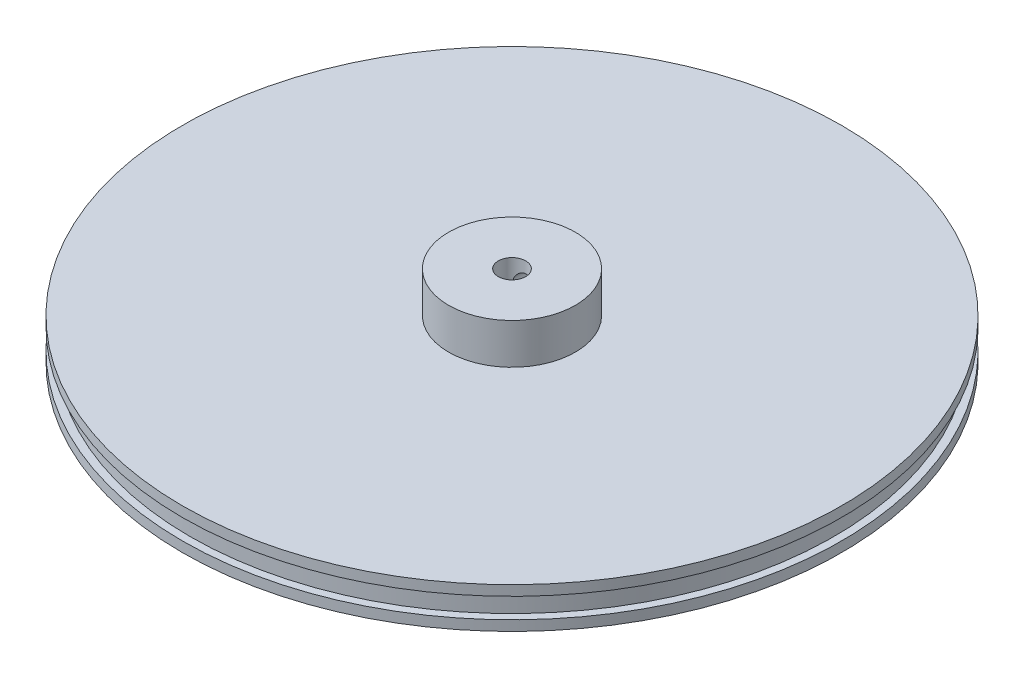
from build123d import *

# Parameters (mm, degrees)
SKETCH1_R           = 32.5
SKETCH1_R_2         = 1.35
BOSS_EXTRUDE1_DEPTH = 4
SKETCH1_3_R         = 6.25
SKETCH1_3_R_2       = 1.35
BOSS_EXTRUDE2_DEPTH = 8
SKETCH2_W           = 0.75
SKETCH2_H           = 2
SKETCH3_R           = 0.9
CUT_EXTRUDE1_DEPTH  = 10


with BuildPart() as part:
    # Sketch1 → Boss-Extrude1 (new body)
    with BuildSketch(Plane(origin=(0, 0, 0), x_dir=(1, 0, 0), z_dir=(0, 1, 0))):
        Circle(SKETCH1_R)
        Circle(SKETCH1_R_2, mode=Mode.SUBTRACT)
    extrude(amount=BOSS_EXTRUDE1_DEPTH)

    # Sketch1<3> → Boss-Extrude2 (add)
    with BuildSketch(Plane(origin=(0, 0, 0), x_dir=(1, 0, 0), z_dir=(0, 1, 0))):
        Circle(SKETCH1_3_R)
        Circle(SKETCH1_3_R_2, mode=Mode.SUBTRACT)
    extrude(amount=BOSS_EXTRUDE2_DEPTH)

    # Sketch2 → Cut-Revolve1 (revolve, cut)
    with BuildSketch(Plane.XY):
        with Locations((32.125, 2)):
            Rectangle(SKETCH2_W, SKETCH2_H)
    revolve(axis=Axis((0, 4, 0), (0, -1, 0)), mode=Mode.SUBTRACT)

    # Sketch3 → Cut-Extrude1 (cut)
    with BuildSketch(Plane.XY):
        with Locations((0, 6)):
            Circle(SKETCH3_R)
    extrude(amount=-CUT_EXTRUDE1_DEPTH, mode=Mode.SUBTRACT)


solid = part.part
